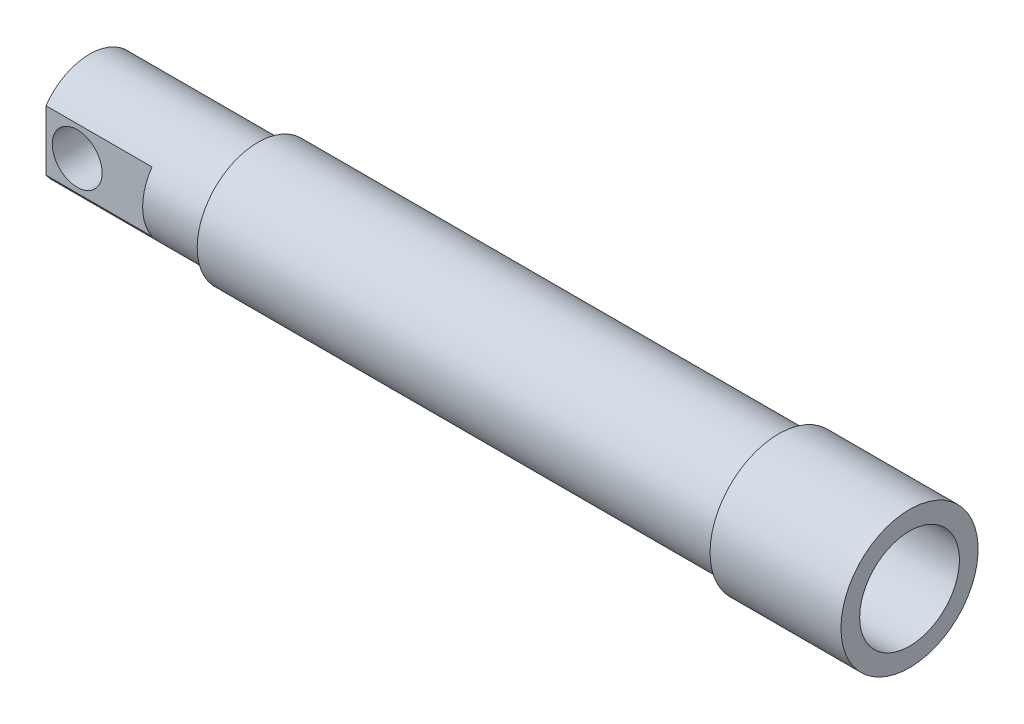
from build123d import *

# Parameters (mm, degrees)
SKETCH2_R           = 26.9875
BOSS_EXTRUDE1_DEPTH = 85.725
CUT_EXTRUDE1_START  = -53.975
CUT_EXTRUDE1_DEPTH  = 53.975
SKETCH4_R           = 12.7
CUT_EXTRUDE2_DEPTH  = 261.380247862
SKETCH8_R           = 12.7
CUT_EXTRUDE3_DEPTH  = 26.9875


with BuildPart() as part:
    # Sketch1 → Revolve1 (revolve)
    with BuildSketch(Plane.XY):
        Polygon((165.89375, 34.925), (99.21875, 34.925), (99.21875, 30.95625), (-165.89375, 30.95625), (-165.89375, 25.4), (165.89375, 25.4), align=None)
    revolve(axis=Axis((-165.89375, 0, 0), (1, 0, 0)))

    # Sketch2 → Boss-Extrude1 (add)
    with BuildSketch(Plane.ZY.offset(165.89375)):
        Circle(SKETCH2_R)
    extrude(amount=BOSS_EXTRUDE1_DEPTH)

    # Sketch3 → Cut-Extrude1 (cut)
    with BuildSketch(Plane.ZY.offset(251.61875).offset(CUT_EXTRUDE1_START)):
        with BuildLine():
            Line((-22.225, 15.309295583), (-22.225, -15.309295583))
            ThreePointArc((-22.225, -15.309295583), (-26.9875, 0), (-22.225, 15.309295583))
        make_face()
        with BuildLine():
            Line((22.225, 15.309295583), (22.225, -15.309295583))
            ThreePointArc((22.225, -15.309295583), (26.9875, 0), (22.225, 15.309295583))
        make_face()
    extrude(amount=CUT_EXTRUDE1_DEPTH, mode=Mode.SUBTRACT)

    # Sketch4 → Cut-Extrude2 (cut, through all)
    with BuildSketch(Plane.XY.offset(22.225)):
        with Locations((-235.74375, 0)):
            Circle(SKETCH4_R)
    extrude(amount=-CUT_EXTRUDE2_DEPTH, mode=Mode.SUBTRACT)

    # Sketch6 → 1/4 NPT Tapped Hole1 (revolve, cut)
    with BuildSketch(Plane(origin=(-181.76875, 0, -26.9875), x_dir=(0, 1, 0), z_dir=(1, 0, 0))):
        Polygon((0, 0), (0, 20.411147279), (5.5626, 17.0688), (5.5626, 10.0203), (6.557978799, 10.0203), (6.858, 0), align=None)
    revolve(axis=Axis((-181.76875, 0, -33.3375), (0, 0, 1)), mode=Mode.SUBTRACT)

    # Sketch8 → Cut-Extrude3 (cut)
    with BuildSketch(Plane(origin=(-165.89375, 0, 0), x_dir=(0, 0, -1), z_dir=(1, 0, 0))):
        Circle(SKETCH8_R)
    extrude(amount=-CUT_EXTRUDE3_DEPTH, mode=Mode.SUBTRACT)


solid = part.part
